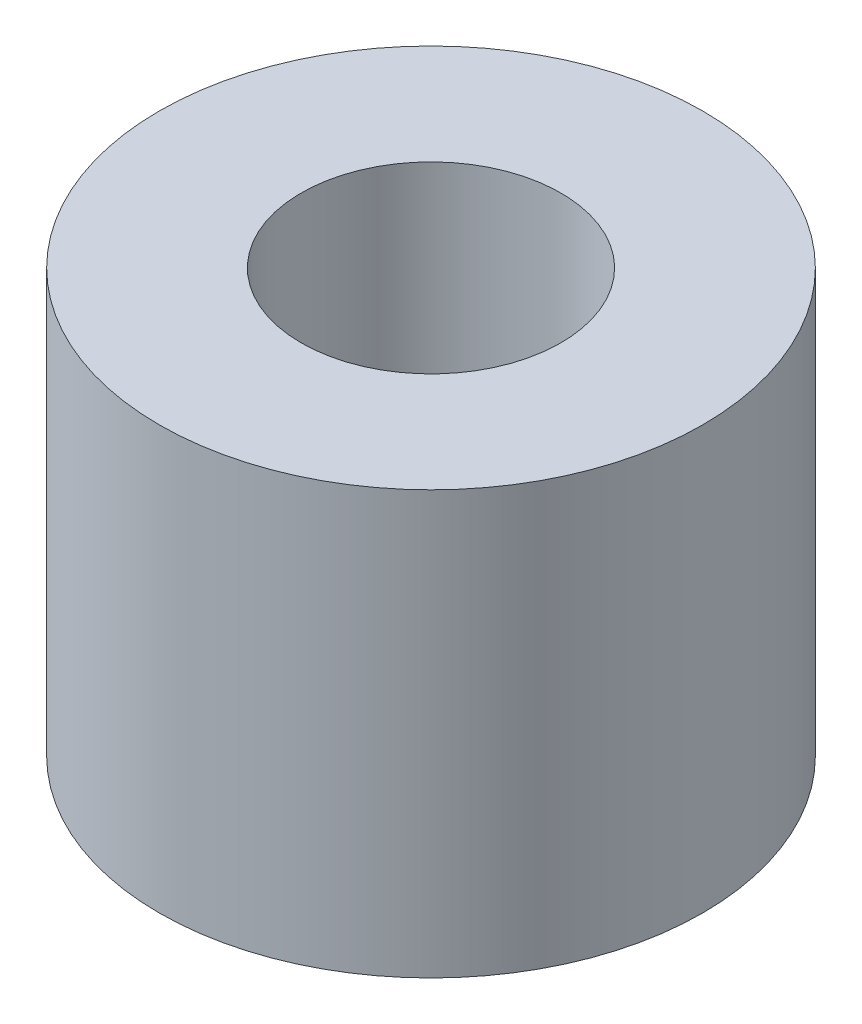
from build123d import *

# Parameters (mm, degrees)
SKETCH_1_R      = 4.5
SKETCH_1_R_2    = 2.15
EXTRUDE_1_DEPTH = 7


with BuildPart() as part:
    # Эскиз1 → Бобышка-Вытянуть1 (new body)
    with BuildSketch(Plane(origin=(0, 0, 0), x_dir=(1, 0, 0), z_dir=(0, 1, 0))):
        Circle(SKETCH_1_R)
        Circle(SKETCH_1_R_2, mode=Mode.SUBTRACT)
    extrude(amount=EXTRUDE_1_DEPTH)


solid = part.part
